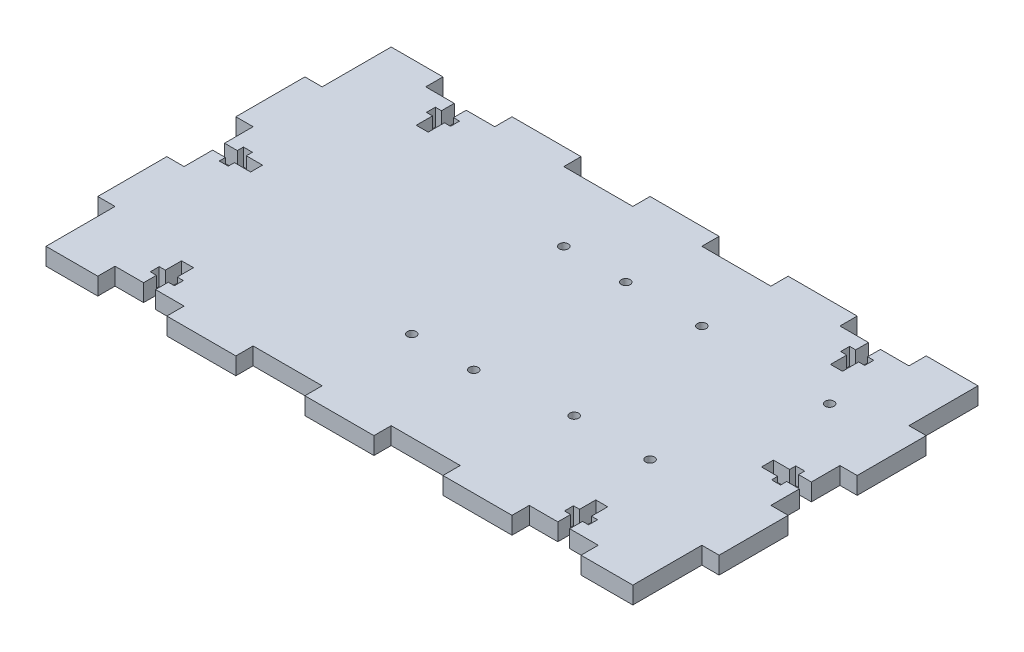
from build123d import *

# Parameters (mm, degrees)
SKETCH1_W                 = 228.6
SKETCH1_H                 = 127
BOSS_EXTRUDE1_DEPTH       = 6.35
SKETCH2_W                 = 6.35
SKETCH2_H                 = 25.4
CUT_EXTRUDE1_DEPTH        = 6.35
LPATTERN1_COUNT           = 3
LPATTERN1_PITCH           = 50.8
LPATTERN1_COUNT_DIR2      = 2
LPATTERN1_PITCH_DIR2      = 222.25
SKETCH3_W                 = 25.4
SKETCH3_H                 = 6.35
CUT_EXTRUDE2_DEPTH        = 6.35
LPATTERN2_COUNT           = 4
LPATTERN2_PITCH           = 50.8
LPATTERN2_COUNT_DIR2      = 2
LPATTERN2_PITCH_DIR2      = 120.65
SKETCH4_W                 = 13.97
SKETCH4_H                 = 4.3942
SKETCH4_W_2               = 3.302
SKETCH4_H_2               = 8.89
CUT_EXTRUDE3_DEPTH        = 8.89
SKETCH5_W                 = 4.3942
SKETCH5_H                 = 13.97
SKETCH5_W_2               = 8.89
SKETCH5_H_2               = 3.302
CUT_EXTRUDE4_DEPTH        = 30.48
MIRROR3_COPY_1_SKETCH_W   = 4.3942
MIRROR3_COPY_1_SKETCH_H   = 13.97
MIRROR3_COPY_1_SKETCH_W_2 = 8.89
MIRROR3_COPY_1_SKETCH_H_2 = 3.302
MIRROR3_COPY_1_DEPTH      = 30.48
MIRROR3_COPY_2_SKETCH_W   = 4.3942
MIRROR3_COPY_2_SKETCH_H   = 13.97
MIRROR3_COPY_2_SKETCH_W_2 = 8.89
MIRROR3_COPY_2_SKETCH_H_2 = 3.302
MIRROR3_COPY_2_DEPTH      = 30.48
F_4_CLEARANCE_HOLE1_D     = 3.2639
F_4_CLEARANCE_HOLE1_DEPTH = 10.16
F_4_CLEARANCE_HOLE1_TIP   = 0.980574487
F_4_CLEARANCE_HOLE2_D     = 3.2639
F_4_CLEARANCE_HOLE2_DEPTH = 10.16
F_4_CLEARANCE_HOLE2_TIP   = 0.980574487


with BuildPart() as part:
    # Sketch1 → Boss-Extrude1 (new body)
    with BuildSketch(Plane(origin=(0, 0, 0), x_dir=(1, 0, 0), z_dir=(0, 1, 0))):
        with Locations((114.3, 63.5)):
            Rectangle(SKETCH1_W, SKETCH1_H)
    extrude(amount=BOSS_EXTRUDE1_DEPTH)

    # Sketch2 → Cut-Extrude1 (cut)
    with BuildSketch(Plane(origin=(0, 6.35, 0), x_dir=(1, 0, 0), z_dir=(0, 1, 0))):
        with Locations((3.175, 114.3)):
            Rectangle(SKETCH2_W, SKETCH2_H)
    cut_extrude1 = extrude(amount=-CUT_EXTRUDE1_DEPTH, mode=Mode.SUBTRACT)

    # LPattern1: Cut-Extrude1 3 × 2
    with Locations(*[(j * LPATTERN1_PITCH_DIR2, 0, i * LPATTERN1_PITCH) for i in range(LPATTERN1_COUNT) for j in range(LPATTERN1_COUNT_DIR2) if (i, j) != (0, 0)]):
        add(cut_extrude1, mode=Mode.SUBTRACT)

    # Sketch3 → Cut-Extrude2 (cut)
    with BuildSketch(Plane(origin=(0, 6.35, 0), x_dir=(1, 0, 0), z_dir=(0, 1, 0))):
        with Locations((38.1, 3.175)):
            Rectangle(SKETCH3_W, SKETCH3_H)
    cut_extrude2 = extrude(amount=-CUT_EXTRUDE2_DEPTH, mode=Mode.SUBTRACT)

    # LPattern2: Cut-Extrude2 4 × 2
    with Locations(*[(i * LPATTERN2_PITCH, 0, -j * LPATTERN2_PITCH_DIR2) for i in range(LPATTERN2_COUNT) for j in range(LPATTERN2_COUNT_DIR2) if (i, j) != (0, 0)]):
        add(cut_extrude2, mode=Mode.SUBTRACT)

    # Sketch4 → Cut-Extrude3 (cut)
    with BuildSketch(Plane(origin=(0, 6.35, 0), x_dir=(1, 0, 0), z_dir=(0, 1, 0))):
        with Locations((215.265, 63.5)):
            Rectangle(SKETCH4_W, SKETCH4_H)
        with Locations((215.9, 63.5)):
            Rectangle(SKETCH4_W_2, SKETCH4_H_2)
    cut_extrude3 = extrude(amount=-CUT_EXTRUDE3_DEPTH, mode=Mode.SUBTRACT)

    # Mirror1: Cut-Extrude3 across plane
    add(cut_extrude3.mirror(Plane(origin=(114.3, 0, 0), x_dir=(0, 0, 1), z_dir=(1, 0, 0))), mode=Mode.SUBTRACT)

    # Sketch5 → Cut-Extrude4 (cut)
    with BuildSketch(Plane(origin=(0, 6.35, 0), x_dir=(1, 0, 0), z_dir=(0, 1, 0))):
        with Locations((38.1, 13.335)):
            Rectangle(SKETCH5_W, SKETCH5_H)
        with Locations((38.1, 12.7)):
            Rectangle(SKETCH5_W_2, SKETCH5_H_2)
    cut_extrude4 = extrude(amount=-CUT_EXTRUDE4_DEPTH, mode=Mode.SUBTRACT)

    # Mirror2: Cut-Extrude4 across plane
    add(cut_extrude4.mirror(Plane(origin=(114.3, 0, 0), x_dir=(0, 0, 1), z_dir=(1, 0, 0))), mode=Mode.SUBTRACT)

    # Mirror3 copy 1 sketch → Mirror3 copy 1 (cut)
    with BuildSketch(Plane(origin=(228.6, 6.35, -127), x_dir=(-1, 0, 0), z_dir=(0, 1, 0))):
        with Locations((38.1, 13.335)):
            Rectangle(MIRROR3_COPY_1_SKETCH_W, MIRROR3_COPY_1_SKETCH_H)
        with Locations((38.1, 12.7)):
            Rectangle(MIRROR3_COPY_1_SKETCH_W_2, MIRROR3_COPY_1_SKETCH_H_2)
    extrude(amount=-MIRROR3_COPY_1_DEPTH, mode=Mode.SUBTRACT)

    # Mirror3 copy 2 sketch → Mirror3 copy 2 (cut)
    with BuildSketch(Plane(origin=(0, 6.35, -127), x_dir=(1, 0, 0), z_dir=(0, 1, 0))):
        with Locations((38.1, -13.335)):
            Rectangle(MIRROR3_COPY_2_SKETCH_W, MIRROR3_COPY_2_SKETCH_H)
        with Locations((38.1, -12.7)):
            Rectangle(MIRROR3_COPY_2_SKETCH_W_2, MIRROR3_COPY_2_SKETCH_H_2)
    extrude(amount=-MIRROR3_COPY_2_DEPTH, mode=Mode.SUBTRACT)

    # #4 Clearance Hole1
    with Locations(Plane(origin=(0, 6.35, 0), x_dir=(1, 0, 0), z_dir=(0, 1, 0))):
        with Locations((152.4, 95.25), (200.66, 93.98), (185.42, 43.18), (157.48, 43.18)):
            Hole(F_4_CLEARANCE_HOLE1_D / 2, depth=F_4_CLEARANCE_HOLE1_DEPTH)
            with Locations((0, 0, -(F_4_CLEARANCE_HOLE1_DEPTH + F_4_CLEARANCE_HOLE1_TIP / 2))):  # 118° drill point
                Cone(0, F_4_CLEARANCE_HOLE1_D / 2, F_4_CLEARANCE_HOLE1_TIP, mode=Mode.SUBTRACT)

    # #4 Clearance Hole2
    with Locations(Plane(origin=(0, 6.35, 0), x_dir=(1, 0, 0), z_dir=(0, 1, 0))):
        with Locations((101.6, 95.25), (124.4092, 95.25), (124.4092, 39.3192), (101.6, 39.3192)):
            Hole(F_4_CLEARANCE_HOLE2_D / 2, depth=F_4_CLEARANCE_HOLE2_DEPTH)
            with Locations((0, 0, -(F_4_CLEARANCE_HOLE2_DEPTH + F_4_CLEARANCE_HOLE2_TIP / 2))):  # 118° drill point
                Cone(0, F_4_CLEARANCE_HOLE2_D / 2, F_4_CLEARANCE_HOLE2_TIP, mode=Mode.SUBTRACT)


solid = part.part
